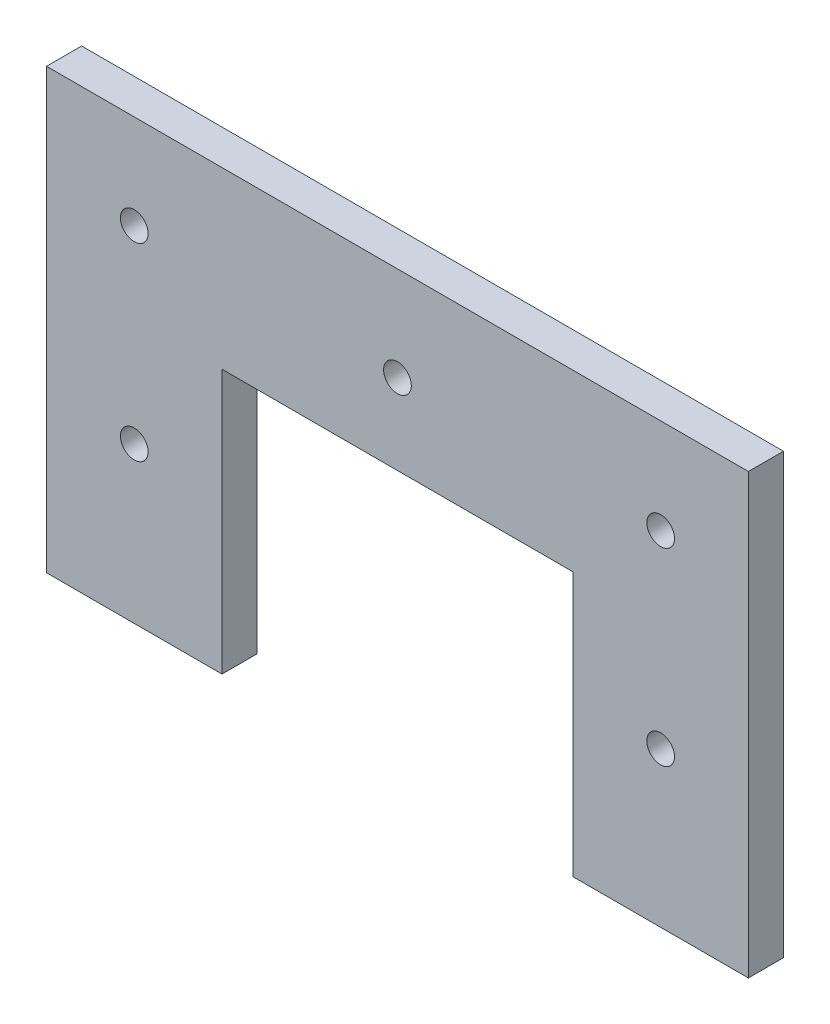
from build123d import *

# Parameters (mm, degrees)
CROQUIS1_R              = 1.58
SALIENTE_EXTRUIR1_DEPTH = 4


with BuildPart() as part:
    # Croquis1 → Saliente-Extruir1 (new body)
    with BuildSketch(Plane.XY):
        Polygon((20.188050923, 6.699416954), (60.188050923, 6.699416954), (60.188050923, -23.395643676), (80.188050923, -23.395643676), (80.188050923, 6.604356324), (80.188050923, 26.604356324), (0.188050923, 26.604356324), (0.188050923, 6.604356324), (0.188050923, -23.395643676), (20.188050923, -23.395643676), align=None)
        with Locations((40.188050923, 15.866498333)):
            Circle(CROQUIS1_R, mode=Mode.SUBTRACT)
        with Locations((10.188050923, 15.866498333)):
            Circle(CROQUIS1_R, mode=Mode.SUBTRACT)
        with Locations((70.188050923, 15.771437703)):
            Circle(CROQUIS1_R, mode=Mode.SUBTRACT)
        with Locations((10.188050923, -5.676497666)):
            Circle(CROQUIS1_R, mode=Mode.SUBTRACT)
        with Locations((70.188050923, -5.771558296)):
            Circle(CROQUIS1_R, mode=Mode.SUBTRACT)
    extrude(amount=SALIENTE_EXTRUIR1_DEPTH)


solid = part.part
